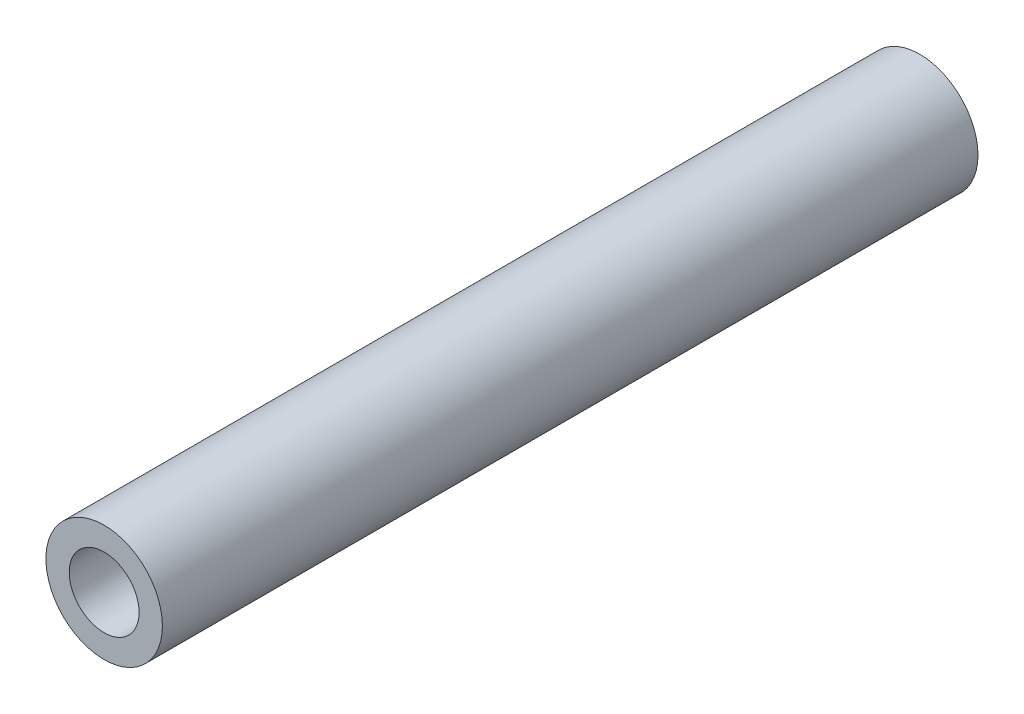
from build123d import *

# Parameters (mm, degrees)
EXTRUDE_311_DEPTH      = 17.5
EXTRUDE_311_DEPTH_BACK = 17.5
SKETCH_1_R             = 2.5
SKETCH_1_R_2           = 1.5


with BuildPart() as part:
    # Эскиз1 → Extrude 311 (new, two sides: drawn at the far end of the back side and taken through both)
    with BuildSketch(Plane.XY.offset(-EXTRUDE_311_DEPTH_BACK)):
        Circle(SKETCH_1_R)
        Circle(SKETCH_1_R_2, mode=Mode.SUBTRACT)
    extrude(amount=EXTRUDE_311_DEPTH + EXTRUDE_311_DEPTH_BACK)


solid = part.part
